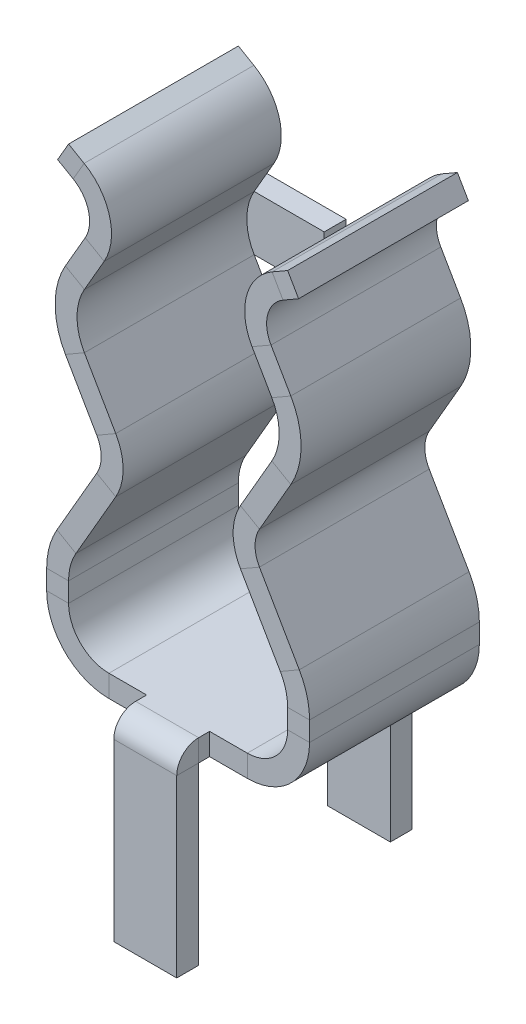
from build123d import *

# Parameters (mm, degrees)
SM_BASE_FLANGE_1_DEPTH = 3.1
SKETCH_11_W            = 1.15
SKETCH_11_H            = 0.4
SKETCH_13_W            = 1.15
SKETCH_13_H            = 0.4
SKETCH_15_W            = 1.712954878
SKETCH_15_H            = 1
EXTRUDE_1_DEPTH        = 0.4
FILLET_1_R             = 0.25


# Sheet-metal steps are written as plain solids
with BuildPart() as part:
    # Sketch 1 → 基体-法兰1 (new body)
    with BuildSketch(Plane.XY):
        with BuildLine():
            Line((0, 8), (0.283974596, 7.83604719))
            ThreePointArc((0.283974596, 7.83604719), (0.749900423, 7.228840832), (0.65, 6.470021787))
            Line((0.65, 6.470021787), (0.288675135, 5.844188762))
            ThreePointArc((0.288675135, 5.844188762), (0.154700538, 5.344188762), (0.288675135, 4.844188762))
            Line((0.288675135, 4.844188762), (0.861324865, 3.852330333))
            ThreePointArc((0.861324865, 3.852330333), (0.995299462, 3.352330333), (0.861324865, 2.852330333))
            Line((0.861324865, 2.852330333), (0.133974596, 1.592522712))
            ThreePointArc((0.133974596, 1.592522712), (0.034074174, 1.351341757), (0, 1.092522712))
            Line((0, 1.092522712), (0, 0.7366))
            ThreePointArc((0, 0.7366), (0.215745145, 0.215745145), (0.7366, 0))
            Line((0.7366, 0), (3.2634, 0))
            ThreePointArc((3.2634, 0), (3.784254855, 0.215745145), (4, 0.7366))
            Line((4, 0.7366), (4, 1.092522712))
            ThreePointArc((4, 1.092522712), (3.965925826, 1.351341757), (3.866025404, 1.592522712))
            Line((3.866025404, 1.592522712), (3.138675135, 2.852330333))
            ThreePointArc((3.138675135, 2.852330333), (3.004700538, 3.352330333), (3.138675135, 3.852330333))
            Line((3.138675135, 3.852330333), (3.711324865, 4.844188762))
            ThreePointArc((3.711324865, 4.844188762), (3.845299462, 5.344188762), (3.711324865, 5.844188762))
            Line((3.711324865, 5.844188762), (3.35, 6.470021787))
            ThreePointArc((3.35, 6.470021787), (3.250099577, 7.228840832), (3.716025404, 7.83604719))
            Line((3.716025404, 7.83604719), (4, 8))
            Line((4, 8), (4.2, 7.653589838))
            Line((4.2, 7.653589838), (3.916025404, 7.489637029))
            ThreePointArc((3.916025404, 7.489637029), (3.636469908, 7.125313214), (3.696410162, 6.670021787))
            Line((3.696410162, 6.670021787), (4.057735027, 6.044188762))
            ThreePointArc((4.057735027, 6.044188762), (4.245299462, 5.344188762), (4.057735027, 4.644188762))
            Line((4.057735027, 4.644188762), (3.485085296, 3.652330333))
            ThreePointArc((3.485085296, 3.652330333), (3.404700538, 3.352330333), (3.485085296, 3.052330333))
            Line((3.485085296, 3.052330333), (4.212435565, 1.792522712))
            ThreePointArc((4.212435565, 1.792522712), (4.352296157, 1.454869375), (4.4, 1.092522712))
            Line((4.4, 1.092522712), (4.4, 0.7366))
            ThreePointArc((4.4, 0.7366), (4.067097567, -0.067097567), (3.2634, -0.4))
            Line((3.2634, -0.4), (0.7366, -0.4))
            ThreePointArc((0.7366, -0.4), (-0.067097567, -0.067097567), (-0.4, 0.7366))
            Line((-0.4, 0.7366), (-0.4, 1.092522712))
            ThreePointArc((-0.4, 1.092522712), (-0.352296157, 1.454869375), (-0.212435565, 1.792522712))
            Line((-0.212435565, 1.792522712), (0.514914704, 3.052330333))
            ThreePointArc((0.514914704, 3.052330333), (0.595299462, 3.352330333), (0.514914704, 3.652330333))
            Line((0.514914704, 3.652330333), (-0.057735027, 4.644188762))
            ThreePointArc((-0.057735027, 4.644188762), (-0.245299462, 5.344188762), (-0.057735027, 6.044188762))
            Line((-0.057735027, 6.044188762), (0.303589838, 6.670021787))
            ThreePointArc((0.303589838, 6.670021787), (0.363530092, 7.125313214), (0.083974596, 7.489637029))
            Line((0.083974596, 7.489637029), (-0.2, 7.653589838))
            Line((-0.2, 7.653589838), (0, 8))
        make_face()
    extrude(amount=SM_BASE_FLANGE_1_DEPTH)

    # 扫描1: sweep along a path in 草图12
    with BuildLine(Plane(origin=(2, 0, 0), x_dir=(0, 0, -1), z_dir=(1, 0, 0))) as sweep_1_path:
        Line((-3.5, -3.6), (-3.5, -0.4))
        ThreePointArc((-3.5, -0.4), (-3.441421356, -0.258578644), (-3.3, -0.2))
        Line((-3.3, -0.2), (-3.1, -0.2))
    # 草图11 → 扫描1 (sweep)
    with BuildSketch(Plane.XY.offset(3.1)):
        with Locations((2, -0.2)):
            Rectangle(SKETCH_11_W, SKETCH_11_H)
    sweep(path=sweep_1_path.line)

    # 扫描2: sweep along a path in 草图14
    with BuildLine(Plane(origin=(2, 0, 0), x_dir=(0, 0, -1), z_dir=(1, 0, 0))) as sweep_2_path:
        Line((0, -0.2), (0.2, -0.2))
        ThreePointArc((0.2, -0.2), (0.341421356, -0.258578644), (0.4, -0.4))
        Line((0.4, -0.4), (0.4, -3.4))
    # 草图13 → 扫描2 (sweep)
    with BuildSketch(Plane(origin=(0, 0, 0), x_dir=(-1, 0, 0), z_dir=(0, 0, -1))):
        with Locations((-2, -0.2)):
            Rectangle(SKETCH_13_W, SKETCH_13_H)
    sweep(path=sweep_2_path.line)

    # 草图15 → 凸台-拉伸1 (add)
    with BuildSketch(Plane(origin=(0, 0, 0), x_dir=(-1, 0, 0), z_dir=(0, 0, -1))):
        with Locations((-0.710838396, 5.344188762)):
            Rectangle(SKETCH_15_W, SKETCH_15_H)
    extrude(amount=EXTRUDE_1_DEPTH)

    # 圆角1
    fillet_1_edges = [part.edges().sort_by_distance(p)[0] for p in [
        (-0.145639043, 4.844188762, -0.2),
        (-0.145639043, 5.844188762, -0.2),
        (-0.145639043, 5.344188762, -0.4),
    ]]
    fillet(fillet_1_edges, radius=FILLET_1_R)


solid = part.part
